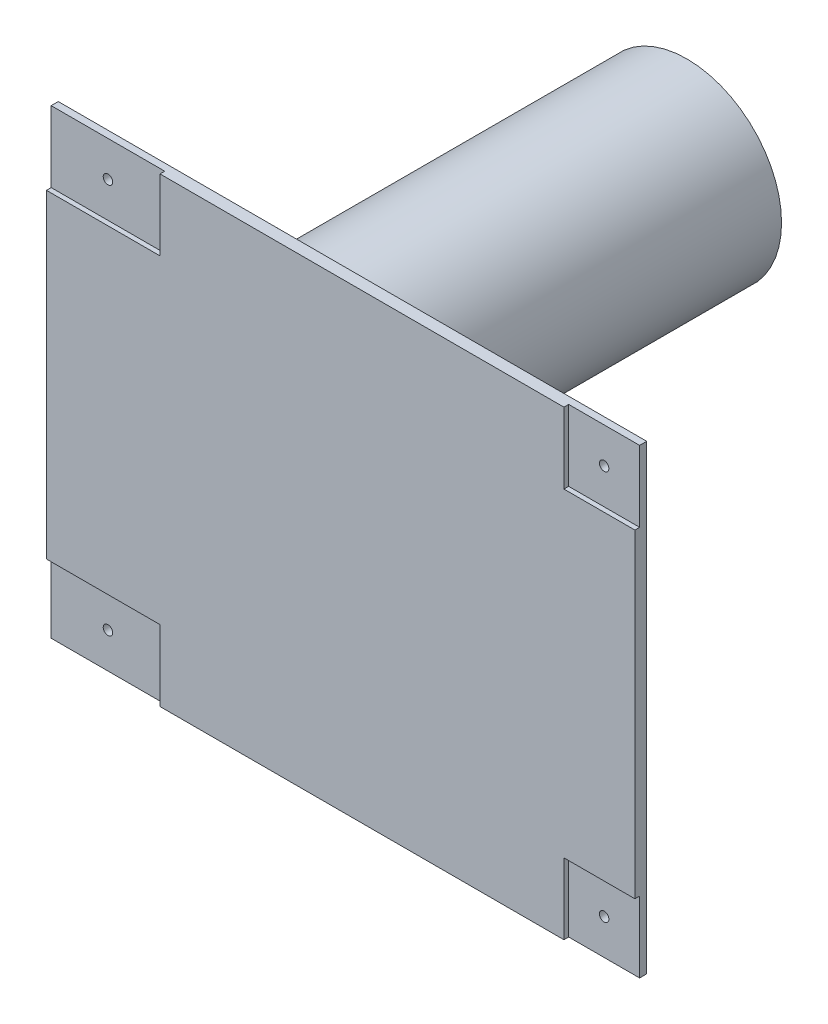
from build123d import *

# Parameters (mm, degrees)
CROQUIS1_W              = 248.76
CROQUIS1_H              = 195
SALIENTE_EXTRUIR1_DEPTH = 5
CROQUIS2_W              = 48
CROQUIS2_H              = 30
CROQUIS2_W_2            = 30
CORTAR_EXTRUIR1_DEPTH   = 2
CROQUIS3_R              = 2
CORTAR_EXTRUIR2_DEPTH   = 10
CROQUIS4_R              = 40
SALIENTE_EXTRUIR2_DEPTH = 206


with BuildPart() as part:
    # Croquis1 → Saliente-Extruir1 (new body)
    with BuildSketch(Plane.XY):
        with Locations((7.088293187, 0.26268)):
            Rectangle(CROQUIS1_W, CROQUIS1_H)
    extrude(amount=SALIENTE_EXTRUIR1_DEPTH)

    # Croquis2 → Cortar-Extruir1 (cut)
    with BuildSketch(Plane.XY.offset(5)):
        with Locations((-93.291706813, -82.23732)):
            Rectangle(CROQUIS2_W, CROQUIS2_H)
        with Locations((116.468293187, 82.76268)):
            Rectangle(CROQUIS2_W_2, CROQUIS2_H)
        with Locations((116.468293187, -82.23732)):
            Rectangle(CROQUIS2_W_2, CROQUIS2_H)
        with Locations((-93.291706813, 82.76268)):
            Rectangle(CROQUIS2_W, CROQUIS2_H)
    extrude(amount=-CORTAR_EXTRUIR1_DEPTH, mode=Mode.SUBTRACT)

    # Croquis3 → Cortar-Extruir2 (cut)
    with BuildSketch(Plane.XY.offset(5)):
        with Locations((-93.291706813, 82.76268)):
            Circle(CROQUIS3_R)
        with Locations((-93.291706813, -82.23732)):
            Circle(CROQUIS3_R)
        with Locations((116.468293187, 82.76268)):
            Circle(CROQUIS3_R)
        with Locations((116.468293187, -82.23732)):
            Circle(CROQUIS3_R)
    extrude(amount=-CORTAR_EXTRUIR2_DEPTH, mode=Mode.SUBTRACT)

    # Croquis4 → Saliente-Extruir2 (add)
    with BuildSketch(Plane(origin=(0, 0, 0), x_dir=(-1, 0, 0), z_dir=(0, 0, -1))):
        with Locations((57.531706813, 0.26268)):
            Circle(CROQUIS4_R)
    extrude(amount=SALIENTE_EXTRUIR2_DEPTH)


solid = part.part
